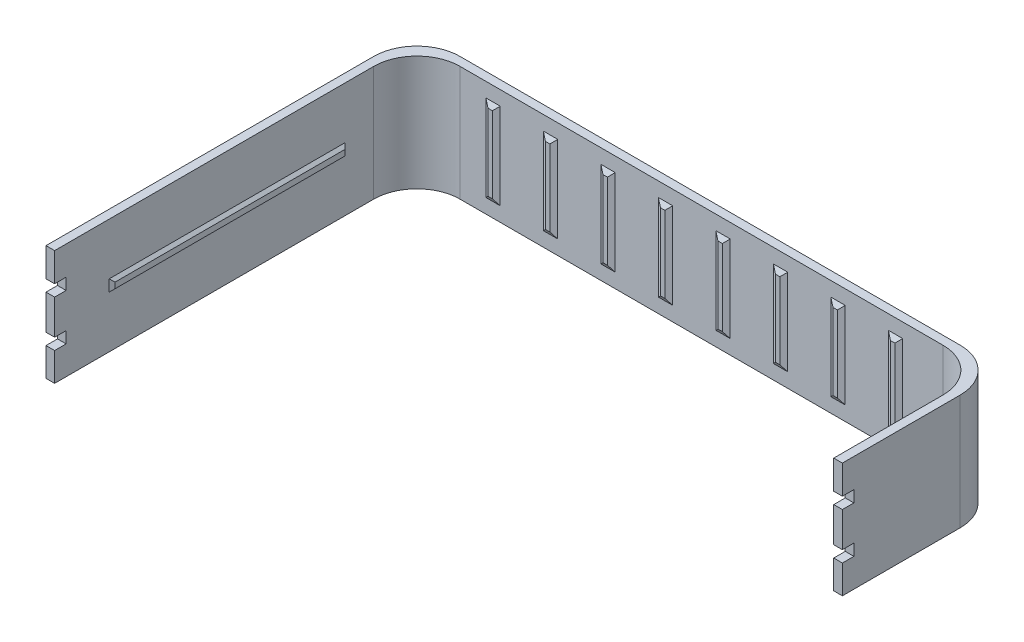
from build123d import *

# Parameters (mm, degrees)
EXTRUDE_1_DEPTH              = 40
FILLET_1_R                   = 15
SKETCH_2_W                   = 1
SKETCH_2_H                   = 26
EXTRUDE_2_DEPTH              = 1
CHAMFER_1_SIZE               = 2
CHAMFER_1_SIZE_2             = 1.154700538
PATTERN_LINEAR_1_OUTLINE_W   = 1.535898384
PATTERN_LINEAR_1_OUTLINE_H   = 26.535898384
PATTERN_LINEAR_1_DEPTH       = 1
PATTERN_LINEAR_1_TAPER       = -60
PATTERN_LINEAR_1_2_OUTLINE_W = 1.535898384
PATTERN_LINEAR_1_2_OUTLINE_H = 26.535898384
PATTERN_LINEAR_1_2_DEPTH     = 1
PATTERN_LINEAR_1_2_TAPER     = -60
PATTERN_LINEAR_1_3_OUTLINE_W = 1.535898384
PATTERN_LINEAR_1_3_OUTLINE_H = 26.535898384
PATTERN_LINEAR_1_3_DEPTH     = 1
PATTERN_LINEAR_1_3_TAPER     = -60
PATTERN_LINEAR_1_4_OUTLINE_W = 1.535898384
PATTERN_LINEAR_1_4_OUTLINE_H = 26.535898384
PATTERN_LINEAR_1_4_DEPTH     = 1
PATTERN_LINEAR_1_4_TAPER     = -60
PATTERN_LINEAR_1_5_OUTLINE_W = 1.535898384
PATTERN_LINEAR_1_5_OUTLINE_H = 26.535898384
PATTERN_LINEAR_1_5_DEPTH     = 1
PATTERN_LINEAR_1_5_TAPER     = -60
PATTERN_LINEAR_1_6_OUTLINE_W = 1.535898384
PATTERN_LINEAR_1_6_OUTLINE_H = 26.535898384
PATTERN_LINEAR_1_6_DEPTH     = 1
PATTERN_LINEAR_1_6_TAPER     = -60
PATTERN_LINEAR_1_7_OUTLINE_W = 1.535898384
PATTERN_LINEAR_1_7_OUTLINE_H = 26.535898384
PATTERN_LINEAR_1_7_DEPTH     = 1
PATTERN_LINEAR_1_7_TAPER     = -60
SKETCH_4_W                   = 1
SKETCH_4_H                   = 2
EXTRUDE_3_DEPTH              = 100
SKETCH_4_3_W                 = 1
SKETCH_4_3_H                 = 2
CUT_EXTRUDE_1_DEPTH          = 20
CHAMFER_3_SIZE               = 1
OTHER_START                  = 9.9
OTHER_3_OUTLINE_W            = 3
OTHER_3_OUTLINE_H            = 4
OTHER_3_DEPTH                = 4
OTHER_START_2                = 26
OTHER_3_2_OUTLINE_W          = 3
OTHER_3_2_OUTLINE_H          = 4
OTHER_3_2_DEPTH              = 4
OTHER_4_OUTLINE_W            = 3
OTHER_4_OUTLINE_H            = 4
OTHER_4_DEPTH                = 4
OTHER_4_2_OUTLINE_W          = 3
OTHER_4_2_OUTLINE_H          = 4
OTHER_4_2_DEPTH              = 4


# Read off the part's stored shape, not the designer's step: Линейный массив1, Отступ3, Отступ4
# Some blends are built 0.0001 mm under size
with BuildPart() as part:
    # Эскиз1 → Бобышка-Вытянуть1 (new body)
    with BuildSketch(Plane(origin=(0, 0, 0), x_dir=(1, 0, 0), z_dir=(0, 1, 0))):
        Polygon((0, 0), (0, 129), (204, 129), (204, 73), (201, 73), (201, 126), (3, 126), (3, 0), align=None)
    extrude(amount=EXTRUDE_1_DEPTH)

    # Скругление1
    fillet_1_edges = [part.edges().sort_by_distance(p)[0] for p in [
        (0, 20, -129),
        (204, 20, -129),
        (201, 20, -126),
        (3, 20, -126),
    ]]
    fillet(fillet_1_edges, radius=FILLET_1_R)

    # Эскиз2 → Бобышка-Вытянуть2 (add)
    with BuildSketch(Plane.XY.offset(-126)):
        with Locations((29.5, 20)):
            Rectangle(SKETCH_2_W, SKETCH_2_H)
    extrude(amount=EXTRUDE_2_DEPTH)

    # Фаска1
    # the kernel refuses this chamfer: 2, 1.154700538 mm, written as the material it adds along each edge
    with BuildSketch(Plane(origin=(30, 7, -126), x_dir=(0, -0.9998132206222077, -0.019326765612703727), z_dir=(-1, 0, 0))) as chamfer_1_piece_1_section:
        Polygon((CHAMFER_1_SIZE * 0.999813220622, CHAMFER_1_SIZE * 0.0193267656127), (-CHAMFER_1_SIZE_2 * 0.0193267656191, CHAMFER_1_SIZE_2 * 0.999813220951), (0, 0), align=None)
    chamfer_1_piece_1 = extrude(amount=1, mode=Mode.PRIVATE)
    chamfer_1_piece_1 = split(chamfer_1_piece_1, bisect_by=Plane(origin=(29.5, 6.310262321, -125), z_dir=(0, 0, -1)), keep=Keep.TOP, mode=Mode.PRIVATE)
    add(chamfer_1_piece_1)
    with BuildSketch(Plane(origin=(29, 7, -126), x_dir=(-0.9998132206222079, 0, -0.019326765612703557), z_dir=(0, 1, 0))) as chamfer_1_piece_2_section:
        Polygon((CHAMFER_1_SIZE * 0.999813220622, CHAMFER_1_SIZE * 0.0193267656127), (-CHAMFER_1_SIZE_2 * 0.0193267656191, CHAMFER_1_SIZE_2 * 0.999813220951), (0, 0), align=None)
    chamfer_1_piece_2 = extrude(amount=26, mode=Mode.PRIVATE)
    chamfer_1_piece_2 = split(chamfer_1_piece_2, bisect_by=Plane(origin=(28.310262321, 20, -125), z_dir=(0, 0, -1)), keep=Keep.TOP, mode=Mode.PRIVATE)
    add(chamfer_1_piece_2)
    with BuildSketch(Plane(origin=(29, 33, -126), x_dir=(0, 0.9998132206222079, -0.019326765612703755), z_dir=(1, 0, 0))) as chamfer_1_piece_3_section:
        Polygon((CHAMFER_1_SIZE * 0.999813220622, CHAMFER_1_SIZE * 0.0193267656127), (-CHAMFER_1_SIZE_2 * 0.0193267656191, CHAMFER_1_SIZE_2 * 0.999813220951), (0, 0), align=None)
    chamfer_1_piece_3 = extrude(amount=1, mode=Mode.PRIVATE)
    chamfer_1_piece_3 = split(chamfer_1_piece_3, bisect_by=Plane(origin=(29.5, 33.689737679, -125), z_dir=(0, 0, -1)), keep=Keep.TOP, mode=Mode.PRIVATE)
    add(chamfer_1_piece_3)
    with BuildSketch(Plane(origin=(30, 33, -126), x_dir=(0.9998132206222077, 0, -0.019326765612703883), z_dir=(0, -1, 0))) as chamfer_1_piece_4_section:
        Polygon((CHAMFER_1_SIZE * 0.999813220622, CHAMFER_1_SIZE * 0.0193267656127), (-CHAMFER_1_SIZE_2 * 0.0193267656191, CHAMFER_1_SIZE_2 * 0.999813220951), (0, 0), align=None)
    chamfer_1_piece_4 = extrude(amount=26, mode=Mode.PRIVATE)
    chamfer_1_piece_4 = split(chamfer_1_piece_4, bisect_by=Plane(origin=(30.689737679, 20, -125), z_dir=(0, 0, -1)), keep=Keep.TOP, mode=Mode.PRIVATE)
    add(chamfer_1_piece_4)
    with BuildSketch(Plane(origin=(35.174171509, 7, -126), x_dir=(0, -0.9998132206222077, -0.019326765612703727), z_dir=(-1, 0, 0))) as chamfer_1_piece_5a_section:
        Polygon((CHAMFER_1_SIZE * 0.999813220622, CHAMFER_1_SIZE * 0.0193267656127), (-CHAMFER_1_SIZE_2 * 0.0193267656191, CHAMFER_1_SIZE_2 * 0.999813220951), (0, 0), align=None)
    chamfer_1_piece_5a = extrude(amount=6.174171509, mode=Mode.PRIVATE)
    chamfer_1_piece_5a = split(chamfer_1_piece_5a, bisect_by=Plane(origin=(30, 6.310262321, -125.650398981), z_dir=(1, 0, 0)), keep=Keep.TOP, mode=Mode.PRIVATE)
    chamfer_1_piece_5a = split(chamfer_1_piece_5a, bisect_by=Plane(origin=(32.587085755, 6.310262321, -125), z_dir=(0, 0, -1)), keep=Keep.TOP, mode=Mode.PRIVATE)
    with BuildSketch(Plane(origin=(30, 33, -126), x_dir=(0.9998132206222077, 0, -0.019326765612703883), z_dir=(0, -1, 0))) as chamfer_1_piece_5b_section:
        Polygon((CHAMFER_1_SIZE * 0.999813220622, CHAMFER_1_SIZE * 0.0193267656127), (-CHAMFER_1_SIZE_2 * 0.0193267656191, CHAMFER_1_SIZE_2 * 0.999813220951), (0, 0), align=None)
    chamfer_1_piece_5b = extrude(amount=31.174171509, mode=Mode.PRIVATE)
    chamfer_1_piece_5b = split(chamfer_1_piece_5b, bisect_by=Plane(origin=(30.689737679, 7, -125.650398981), z_dir=(0, -1, 0)), keep=Keep.TOP, mode=Mode.PRIVATE)
    chamfer_1_piece_5b = split(chamfer_1_piece_5b, bisect_by=Plane(origin=(30.689737679, 4.412914245, -125), z_dir=(0, 0, -1)), keep=Keep.TOP, mode=Mode.PRIVATE)
    chamfer_1_piece_5 = chamfer_1_piece_5a & chamfer_1_piece_5b
    add(chamfer_1_piece_5)
    with BuildSketch(Plane(origin=(29, 1.825828491, -126), x_dir=(-0.9998132206222077, 0, -0.019326765612703717), z_dir=(0, 1, 0))) as chamfer_1_piece_6a_section:
        Polygon((CHAMFER_1_SIZE * 0.999813220622, CHAMFER_1_SIZE * 0.0193267656127), (-CHAMFER_1_SIZE_2 * 0.019326765619, CHAMFER_1_SIZE_2 * 0.999813220951), (0, 0), align=None)
    chamfer_1_piece_6a = extrude(amount=31.174171509, mode=Mode.PRIVATE)
    chamfer_1_piece_6a = split(chamfer_1_piece_6a, bisect_by=Plane(origin=(28.310262321, 7, -125.650398981), z_dir=(0, -1, 0)), keep=Keep.TOP, mode=Mode.PRIVATE)
    chamfer_1_piece_6a = split(chamfer_1_piece_6a, bisect_by=Plane(origin=(28.310262321, 4.412914245, -125), z_dir=(0, 0, -1)), keep=Keep.TOP, mode=Mode.PRIVATE)
    with BuildSketch(Plane(origin=(30, 7, -126), x_dir=(0, -0.9998132206222077, -0.019326765612703727), z_dir=(-1, 0, 0))) as chamfer_1_piece_6b_section:
        Polygon((CHAMFER_1_SIZE * 0.999813220622, CHAMFER_1_SIZE * 0.0193267656127), (-CHAMFER_1_SIZE_2 * 0.0193267656191, CHAMFER_1_SIZE_2 * 0.999813220951), (0, 0), align=None)
    chamfer_1_piece_6b = extrude(amount=6.174171509, mode=Mode.PRIVATE)
    chamfer_1_piece_6b = split(chamfer_1_piece_6b, bisect_by=Plane(origin=(29, 6.310262321, -125.650398981), z_dir=(-1, 0, 0)), keep=Keep.TOP, mode=Mode.PRIVATE)
    chamfer_1_piece_6b = split(chamfer_1_piece_6b, bisect_by=Plane(origin=(26.412914245, 6.310262321, -125), z_dir=(0, 0, -1)), keep=Keep.TOP, mode=Mode.PRIVATE)
    chamfer_1_piece_6 = chamfer_1_piece_6a & chamfer_1_piece_6b
    add(chamfer_1_piece_6)
    with BuildSketch(Plane(origin=(29, 7, -126), x_dir=(-0.9998132206222079, 0, -0.019326765612703557), z_dir=(0, 1, 0))) as chamfer_1_piece_7a_section:
        Polygon((CHAMFER_1_SIZE * 0.999813220622, CHAMFER_1_SIZE * 0.0193267656127), (-CHAMFER_1_SIZE_2 * 0.0193267656191, CHAMFER_1_SIZE_2 * 0.999813220951), (0, 0), align=None)
    chamfer_1_piece_7a = extrude(amount=31.174171509, mode=Mode.PRIVATE)
    chamfer_1_piece_7a = split(chamfer_1_piece_7a, bisect_by=Plane(origin=(28.310262321, 33, -125.650398981), z_dir=(0, 1, 0)), keep=Keep.TOP, mode=Mode.PRIVATE)
    chamfer_1_piece_7a = split(chamfer_1_piece_7a, bisect_by=Plane(origin=(28.310262321, 35.587085755, -125), z_dir=(0, 0, -1)), keep=Keep.TOP, mode=Mode.PRIVATE)
    with BuildSketch(Plane(origin=(23.825828491, 33, -126), x_dir=(0, 0.9998132206222079, -0.019326765612703755), z_dir=(1, 0, 0))) as chamfer_1_piece_7b_section:
        Polygon((CHAMFER_1_SIZE * 0.999813220622, CHAMFER_1_SIZE * 0.0193267656127), (-CHAMFER_1_SIZE_2 * 0.0193267656191, CHAMFER_1_SIZE_2 * 0.999813220951), (0, 0), align=None)
    chamfer_1_piece_7b = extrude(amount=6.174171509, mode=Mode.PRIVATE)
    chamfer_1_piece_7b = split(chamfer_1_piece_7b, bisect_by=Plane(origin=(29, 33.689737679, -125.650398981), z_dir=(-1, 0, 0)), keep=Keep.TOP, mode=Mode.PRIVATE)
    chamfer_1_piece_7b = split(chamfer_1_piece_7b, bisect_by=Plane(origin=(26.412914245, 33.689737679, -125), z_dir=(0, 0, -1)), keep=Keep.TOP, mode=Mode.PRIVATE)
    chamfer_1_piece_7 = chamfer_1_piece_7a & chamfer_1_piece_7b
    add(chamfer_1_piece_7)
    with BuildSketch(Plane(origin=(30, 38.174171509, -126), x_dir=(0.9998132206222079, 0, -0.019326765612703755), z_dir=(0, -1, 0))) as chamfer_1_piece_8a_section:
        Polygon((CHAMFER_1_SIZE * 0.999813220622, CHAMFER_1_SIZE * 0.0193267656127), (-CHAMFER_1_SIZE_2 * 0.019326765619, CHAMFER_1_SIZE_2 * 0.999813220951), (0, 0), align=None)
    chamfer_1_piece_8a = extrude(amount=31.174171509, mode=Mode.PRIVATE)
    chamfer_1_piece_8a = split(chamfer_1_piece_8a, bisect_by=Plane(origin=(30.689737679, 33, -125.650398981), z_dir=(0, 1, 0)), keep=Keep.TOP, mode=Mode.PRIVATE)
    chamfer_1_piece_8a = split(chamfer_1_piece_8a, bisect_by=Plane(origin=(30.689737679, 35.587085755, -125), z_dir=(0, 0, -1)), keep=Keep.TOP, mode=Mode.PRIVATE)
    with BuildSketch(Plane(origin=(29, 33, -126), x_dir=(0, 0.9998132206222079, -0.019326765612703755), z_dir=(1, 0, 0))) as chamfer_1_piece_8b_section:
        Polygon((CHAMFER_1_SIZE * 0.999813220622, CHAMFER_1_SIZE * 0.0193267656127), (-CHAMFER_1_SIZE_2 * 0.0193267656191, CHAMFER_1_SIZE_2 * 0.999813220951), (0, 0), align=None)
    chamfer_1_piece_8b = extrude(amount=6.174171509, mode=Mode.PRIVATE)
    chamfer_1_piece_8b = split(chamfer_1_piece_8b, bisect_by=Plane(origin=(30, 33.689737679, -125.650398981), z_dir=(1, 0, 0)), keep=Keep.TOP, mode=Mode.PRIVATE)
    chamfer_1_piece_8b = split(chamfer_1_piece_8b, bisect_by=Plane(origin=(32.587085755, 33.689737679, -125), z_dir=(0, 0, -1)), keep=Keep.TOP, mode=Mode.PRIVATE)
    chamfer_1_piece_8 = chamfer_1_piece_8a & chamfer_1_piece_8b
    add(chamfer_1_piece_8)

    # Линейный массив1 outline → Линейный массив1 (add)
    with BuildSketch(Plane.XY.offset(-125)):
        with Locations((169.5, 20)):
            Rectangle(PATTERN_LINEAR_1_OUTLINE_W, PATTERN_LINEAR_1_OUTLINE_H)
    extrude(amount=-PATTERN_LINEAR_1_DEPTH, taper=PATTERN_LINEAR_1_TAPER)

    # Pattern Linear 1 2 outline → Pattern Linear 1 2 (add)
    with BuildSketch(Plane.XY.offset(-125)):
        with Locations((149.5, 20)):
            Rectangle(PATTERN_LINEAR_1_2_OUTLINE_W, PATTERN_LINEAR_1_2_OUTLINE_H)
    extrude(amount=-PATTERN_LINEAR_1_2_DEPTH, taper=PATTERN_LINEAR_1_2_TAPER)

    # Pattern Linear 1 3 outline → Pattern Linear 1 3 (add)
    with BuildSketch(Plane.XY.offset(-125)):
        with Locations((129.5, 20)):
            Rectangle(PATTERN_LINEAR_1_3_OUTLINE_W, PATTERN_LINEAR_1_3_OUTLINE_H)
    extrude(amount=-PATTERN_LINEAR_1_3_DEPTH, taper=PATTERN_LINEAR_1_3_TAPER)

    # Pattern Linear 1 4 outline → Pattern Linear 1 4 (add)
    with BuildSketch(Plane.XY.offset(-125)):
        with Locations((109.5, 20)):
            Rectangle(PATTERN_LINEAR_1_4_OUTLINE_W, PATTERN_LINEAR_1_4_OUTLINE_H)
    extrude(amount=-PATTERN_LINEAR_1_4_DEPTH, taper=PATTERN_LINEAR_1_4_TAPER)

    # Pattern Linear 1 5 outline → Pattern Linear 1 5 (add)
    with BuildSketch(Plane.XY.offset(-125)):
        with Locations((89.5, 20)):
            Rectangle(PATTERN_LINEAR_1_5_OUTLINE_W, PATTERN_LINEAR_1_5_OUTLINE_H)
    extrude(amount=-PATTERN_LINEAR_1_5_DEPTH, taper=PATTERN_LINEAR_1_5_TAPER)

    # Pattern Linear 1 6 outline → Pattern Linear 1 6 (add)
    with BuildSketch(Plane.XY.offset(-125)):
        with Locations((69.5, 20)):
            Rectangle(PATTERN_LINEAR_1_6_OUTLINE_W, PATTERN_LINEAR_1_6_OUTLINE_H)
    extrude(amount=-PATTERN_LINEAR_1_6_DEPTH, taper=PATTERN_LINEAR_1_6_TAPER)

    # Pattern Linear 1 7 outline → Pattern Linear 1 7 (add)
    with BuildSketch(Plane.XY.offset(-125)):
        with Locations((49.5, 20)):
            Rectangle(PATTERN_LINEAR_1_7_OUTLINE_W, PATTERN_LINEAR_1_7_OUTLINE_H)
    extrude(amount=-PATTERN_LINEAR_1_7_DEPTH, taper=PATTERN_LINEAR_1_7_TAPER)

    # Эскиз4 → Бобышка-Вытянуть3 (add)
    with BuildSketch(Plane.XY):
        with Locations((3.5, 20)):
            Rectangle(SKETCH_4_W, SKETCH_4_H)
    extrude(amount=-EXTRUDE_3_DEPTH)

    # Эскиз4<3> → Вырез-Вытянуть1 (cut)
    with BuildSketch(Plane.XY):
        with Locations((3.5, 20)):
            Rectangle(SKETCH_4_3_W, SKETCH_4_3_H)
    extrude(amount=-CUT_EXTRUDE_1_DEPTH, mode=Mode.SUBTRACT)

    # Фаска3
    chamfer_3_edges = [part.edges().sort_by_distance(p)[0] for p in [
        (3, 20, -100),
        (3, 21, -60),
        (3, 20, -20),
        (3, 19, -60),
    ]]
    chamfer(chamfer_3_edges, length=CHAMFER_3_SIZE - 0.0001)  # a hair under: the kernel refuses the full size

    # Отступ3 outline → Отступ3 (cut)
    with BuildSketch(Plane(origin=(0, 0, 0), x_dir=(1, 0, 0), z_dir=(0, 1, 0)).offset(OTHER_START)):
        with Locations((202.5, 75)):
            Rectangle(OTHER_3_OUTLINE_W, OTHER_3_OUTLINE_H)
    extrude(amount=OTHER_3_DEPTH, mode=Mode.SUBTRACT)

    # Other 3 2 outline → Other 3 2 (cut)
    with BuildSketch(Plane(origin=(0, 0, 0), x_dir=(1, 0, 0), z_dir=(0, 1, 0)).offset(OTHER_START_2)):
        with Locations((202.5, 75)):
            Rectangle(OTHER_3_2_OUTLINE_W, OTHER_3_2_OUTLINE_H)
    extrude(amount=OTHER_3_2_DEPTH, mode=Mode.SUBTRACT)

    # Отступ4 outline → Отступ4 (cut)
    with BuildSketch(Plane(origin=(0, 0, 0), x_dir=(1, 0, 0), z_dir=(0, 1, 0)).offset(OTHER_START)):
        with Locations((1.5, 2)):
            Rectangle(OTHER_4_OUTLINE_W, OTHER_4_OUTLINE_H)
    extrude(amount=OTHER_4_DEPTH, mode=Mode.SUBTRACT)

    # Other 4 2 outline → Other 4 2 (cut)
    with BuildSketch(Plane(origin=(0, 0, 0), x_dir=(1, 0, 0), z_dir=(0, 1, 0)).offset(OTHER_START_2)):
        with Locations((1.5, 2)):
            Rectangle(OTHER_4_2_OUTLINE_W, OTHER_4_2_OUTLINE_H)
    extrude(amount=OTHER_4_2_DEPTH, mode=Mode.SUBTRACT)


solid = part.part
